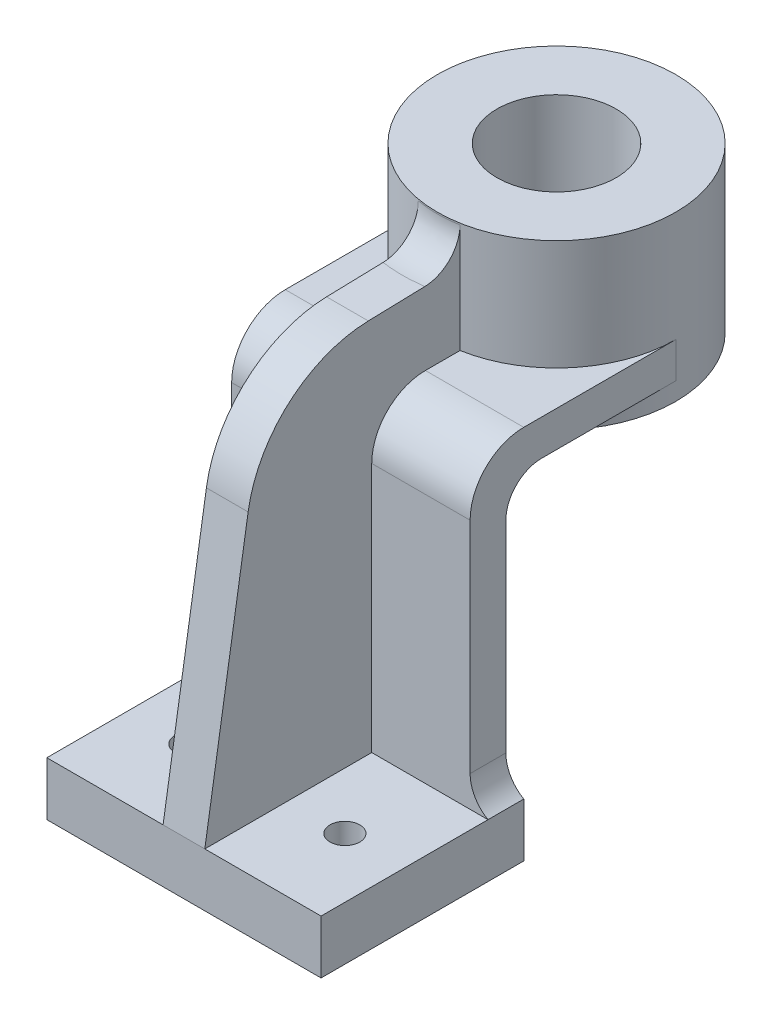
from build123d import *

# Parameters (mm, degrees)
SKETCH1_W                = 68
SKETCH1_H                = 18
BOSS_EXTRUDE1_DEPTH      = 46
BOSS_EXTRUDE2_DEPTH      = 40
FILLET1_R                = 12
FILLET3_R                = 18
FILLET4_R                = 12
BOSS_EXTRUDE3_DEPTH      = 37
BOSS_EXTRUDE3_DEPTH_BACK = 18
SKETCH3_R                = 40
HOLE1_D                  = 40
BOSS_EXTRUDE5_DEPTH      = 7
FILLET5_R                = 12
HOLE2_D                  = 10


with BuildPart() as part:
    # Sketch1 → Boss-Extrude1 (new, symmetric)
    with BuildSketch(Plane(origin=(0, 0, 0), x_dir=(0, 0, -1), z_dir=(1, 0, 0))):
        Rectangle(SKETCH1_W, SKETCH1_H)
    extrude(amount=BOSS_EXTRUDE1_DEPTH, both=True)

    # Sketch2 → Boss-Extrude2 (add, symmetric)
    with BuildSketch(Plane(origin=(0, 0, 0), x_dir=(0, 0, -1), z_dir=(1, 0, 0))):
        Polygon((34, 9), (22, 9), (22, 111), (91, 111), (91, 99), (34, 99), align=None)
    extrude(amount=BOSS_EXTRUDE2_DEPTH, both=True)

    # Fillet1
    # the kernel refuses this fillet: 12 mm, written as the material it adds along each edge
    with BuildSketch(Plane(origin=(-40, 9, -34), x_dir=(-1, 0, 0), z_dir=(0, 0, 1))) as fillet1_piece_1:
        with BuildLine():
            CenterArc((12, -10.392304845), FILLET1_R, 120, 60)
            Line((0, -10.392304845), (-0.24, -10.392304845))
            Line((-0.24, -10.392304845), (-0.24, 0))
            Line((-0.24, 0), (0, 0.24))
            ThreePointArc((0, 0.24), (3, 0.24), (5.88, 0.207846097))
            Line((5.88, 0.207846097), (6, 0))
        make_face()
    extrude(amount=12)
    with BuildSketch(Plane(origin=(40, 9, -34), x_dir=(1, 0, 0), z_dir=(0, 0, 1))) as fillet1_piece_2:
        with BuildLine():
            CenterArc((12, 10.392304845), FILLET1_R, 180, 60)
            Line((0, 10.392304845), (-0.24, 10.392304845))
            Line((-0.24, 10.392304845), (-0.24, 0))
            Line((-0.24, 0), (0, -0.24))
            ThreePointArc((0, -0.24), (3, -0.24), (5.88, -0.207846097))
            Line((5.88, -0.207846097), (6, 0))
        make_face()
    extrude(amount=12)

    # Fillet3
    fillet3_edges = [part.edges().sort_by_distance(p)[0] for p in [
        (0, 111, -22),
    ]]
    fillet(fillet3_edges, radius=FILLET3_R)

    # Fillet4
    fillet4_edges = [part.edges().sort_by_distance(p)[0] for p in [
        (0, 99, -34),
    ]]
    fillet(fillet4_edges, radius=FILLET4_R)

    # Sketch3 → Boss-Extrude3 (add, two sides: drawn at the far end of the back side and taken through both)
    with BuildSketch(Plane(origin=(0, 111, 0), x_dir=(1, 0, 0), z_dir=(0, 1, 0)).offset(-BOSS_EXTRUDE3_DEPTH_BACK)):
        with Locations(Location((0, 91, 0), (0, 0, 270))):
            Circle(SKETCH3_R)
    extrude(amount=BOSS_EXTRUDE3_DEPTH + BOSS_EXTRUDE3_DEPTH_BACK)

    # Hole1 (through all)
    with Locations(Plane(origin=(0, 148, 0), x_dir=(1, 0, 0), z_dir=(0, 1, 0))):
        with Locations((0, 91)):
            Hole(HOLE1_D / 2)

    # Sketch6 → Boss-Extrude5 (add, symmetric)
    with BuildSketch(Plane(origin=(0, 0, 0), x_dir=(0, 0, -1), z_dir=(1, 0, 0))):
        with BuildLine():
            Line((-34, 9), (-19.470663618, 99.647109079))
            ThreePointArc((-19.470663618, 99.647109079), (-5.682290367, 124.586243842), (20.849974888, 134.984252313))
            Line((20.849974888, 134.984252313), (57.932127912, 136))
            Line((57.932127912, 136), (57.932127912, 111))
            Line((57.932127912, 111), (40, 111))
            ThreePointArc((40, 111), (27.272077939, 105.727922061), (22, 93))
            Line((22, 93), (22, 19.392304845))
            Line((22, 19.392304845), (22, 9))
            Line((22, 9), (-34, 9))
        make_face()
    extrude(amount=BOSS_EXTRUDE5_DEPTH, both=True)

    # Fillet5
    fillet5_edges = [part.edges().sort_by_distance(p)[0] for p in [
        (3.513591356, 135.814351592, -51.154615377),
    ]]
    fillet(fillet5_edges, radius=FILLET5_R)

    # Hole2 (through all)
    with Locations(Plane(origin=(0, 9, 0), x_dir=(1, 0, 0), z_dir=(0, 1, 0))):
        with Locations((26, -6)):
            hole2 = Hole(HOLE2_D / 2)

    # Mirror1: Hole2 across plane
    add(hole2.mirror(Plane(origin=(0, 0, 0), x_dir=(0, 0, 1), z_dir=(1, 0, 0))), mode=Mode.SUBTRACT)


solid = part.part
